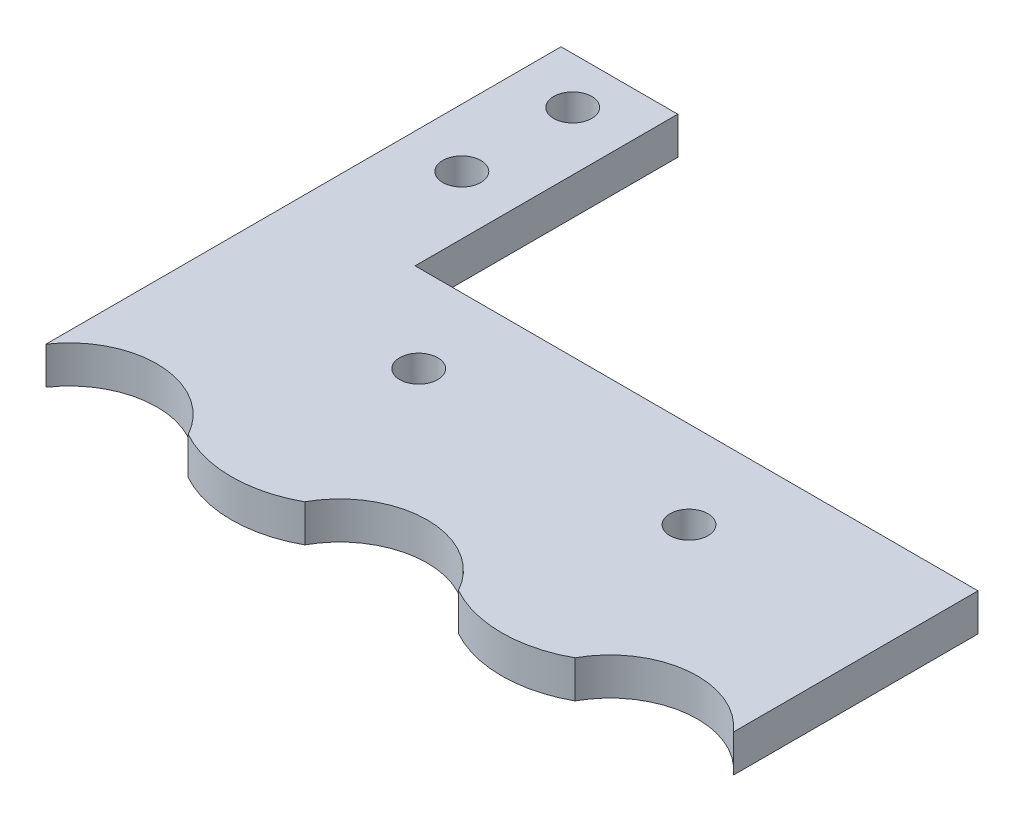
from build123d import *

# Parameters (mm, degrees)
BASE_FLANGE1_START        = -3.2
BASE_FLANGE1_DEPTH        = 3.2
SKETCH8_R                 = 1.635
CUT_EXTRUDE1_DEPTH        = 3.2
F_4_CLEARANCE_HOLE1_D     = 3.2639
F_4_CLEARANCE_HOLE1_DEPTH = 3.2
F_4_CLEARANCE_HOLE1_TIP   = 0.980574487
CUT_EXTRUDE2_DEPTH        = 3.2


# Read off the part's stored shape, not the designer's step: Base-Flange1
with BuildPart() as part:
    # Base-Flange1 outline → Base-Flange1 (new body)
    with BuildSketch(Plane(origin=(0, 0, 0), x_dir=(1, 0, 0), z_dir=(0, 1, 0)).offset(BASE_FLANGE1_START)):
        with BuildLine():
            ThreePointArc((-29.358964924, 3.232453337), (-23.15, 7), (-16.941035076, 3.232453337))
            ThreePointArc((-16.941035076, 3.232453337), (-11.575, 1.808851774), (-6.208964924, 3.232453337))
            ThreePointArc((-6.208964924, 3.232453337), (0, 7), (6.208964924, 3.232453337))
            ThreePointArc((6.208964924, 3.232453337), (11.575, 1.808851774), (16.941035076, 3.232453337))
            ThreePointArc((16.941035076, 3.232453337), (23.15, 7), (29.358964924, 3.232453337))
            Line((29.358964924, 3.232453337), (29.358964924, 25.825))
            Line((29.358964924, 25.825), (-19.358964924, 25.825))
            Line((-19.358964924, 25.825), (-19.358964924, 48.325))
            Line((-19.358964924, 48.325), (-29.358964924, 48.325))
            Line((-29.358964924, 48.325), (-29.358964924, 3.232453337))
        make_face()
    extrude(amount=BASE_FLANGE1_DEPTH)

    # Sketch8 → Cut-Extrude1 (cut)
    with BuildSketch(Plane(origin=(0, 0, 0), x_dir=(1, 0, 0), z_dir=(0, 1, 0))):
        with Locations(Location((-24.358964924, 44.325, 0), (0, 0, 270))):
            Circle(SKETCH8_R)
        with Locations(Location((-24.358964924, 34.825, 0), (0, 0, 270))):
            Circle(SKETCH8_R)
    extrude(amount=-CUT_EXTRUDE1_DEPTH, mode=Mode.SUBTRACT)

    # #4 Clearance Hole1
    with Locations(Plane(origin=(0, 0, 0), x_dir=(1, 0, 0), z_dir=(0, 1, 0))):
        with Locations((11.575, 18.35), (-11.575, 18.35)):
            Hole(F_4_CLEARANCE_HOLE1_D / 2, depth=F_4_CLEARANCE_HOLE1_DEPTH)
            with Locations((0, 0, -(F_4_CLEARANCE_HOLE1_DEPTH + F_4_CLEARANCE_HOLE1_TIP / 2))):  # 118° drill point
                Cone(0, F_4_CLEARANCE_HOLE1_D / 2, F_4_CLEARANCE_HOLE1_TIP, mode=Mode.SUBTRACT)

    # Sketch12 → Cut-Extrude2 (cut)
    with BuildSketch(Plane(origin=(0, 0, 0), x_dir=(1, 0, 0), z_dir=(0, 1, 0))):
        with BuildLine():
            Line((-29.802462418, 3.463342862), (-29.802462418, -1.121913875))
            Line((-29.802462418, -1.121913875), (35.30589457, -1.121913875))
            Line((35.30589457, -1.121913875), (35.30589457, 25.825))
            Line((35.30589457, 25.825), (28.858964924, 25.825))
            Line((28.858964924, 25.825), (28.858964924, 4.863920178))
            ThreePointArc((28.858964924, 4.863920178), (22.380832381, 7.460454488), (16.568740084, 3.596806627))
            ThreePointArc((16.568740084, 3.596806627), (11.575, 2.308851774), (6.581259916, 3.596806627))
            ThreePointArc((6.581259916, 3.596806627), (0, 7.5), (-6.581259916, 3.596806627))
            ThreePointArc((-6.581259916, 3.596806627), (-11.575, 2.308851774), (-16.568740084, 3.596806627))
            ThreePointArc((-16.568740084, 3.596806627), (-23.225634604, 7.499618617), (-29.802462418, 3.463342862))
        make_face()
    extrude(amount=-CUT_EXTRUDE2_DEPTH, mode=Mode.SUBTRACT)


solid = part.part
